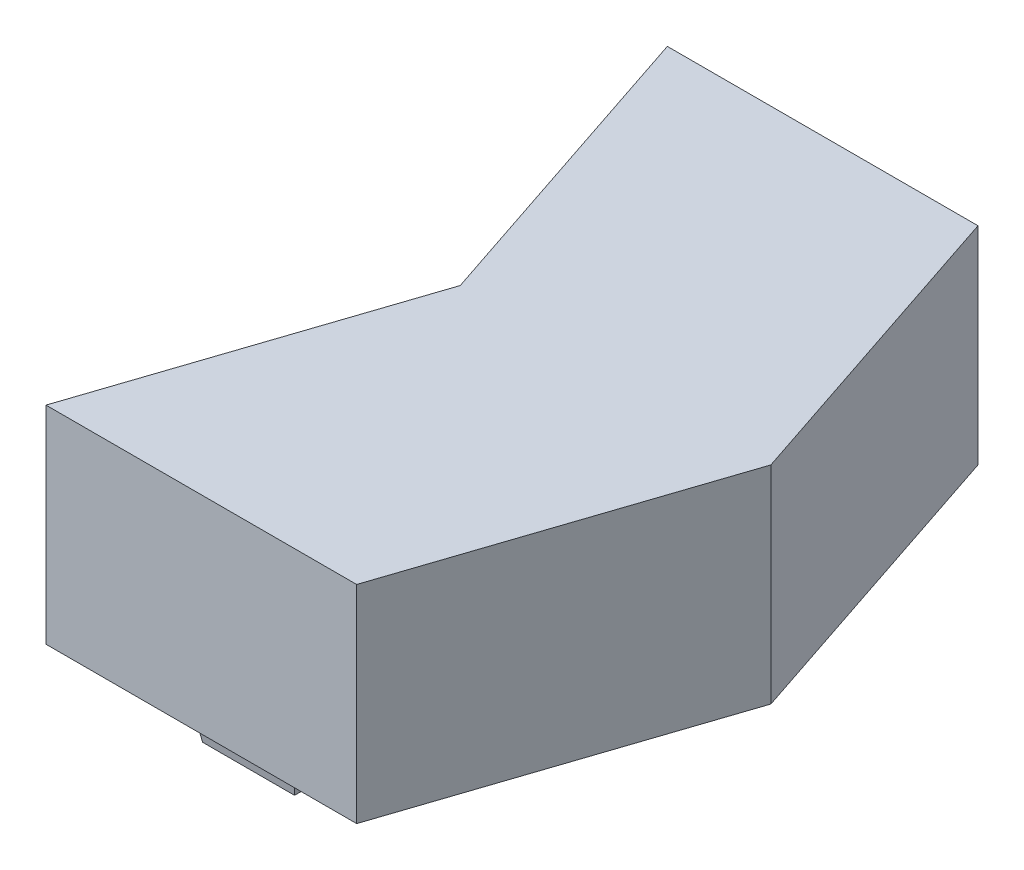
from build123d import *

# Parameters (mm, degrees)
BOSS_EXTRUDE1_DEPTH       = 12.7
SKETCH2_R                 = 5.635000033
HAPTIC_MOTOR_CUTOUT_DEPTH = 9.557999934
SKETCH3_W                 = 2.54
SKETCH3_H                 = 3.81
HAPTIC_WIRE_CUTOUT_DEPTH  = 9.557999934
SKETCH4_W                 = 6.35
SKETCH4_H                 = 2.54
PINS_DEPTH                = 2.032
PINS_TAPER                = 10


with BuildPart() as part:
    # Sketch1 → Boss-Extrude1 (new body)
    with BuildSketch(Plane(origin=(0, 0, 0), x_dir=(1, 0, 0), z_dir=(0, 1, 0))):
        Polygon((0, 0), (19.05, 0), (25.4, 19.05), (19.05, 38.1), (0, 38.1), (6.35, 19.05), align=None)
    extrude(amount=BOSS_EXTRUDE1_DEPTH)

    # Sketch2 → Haptic Motor Cutout (cut)
    with BuildSketch(Plane.XZ):
        with Locations((15.24, -19.05)):
            Circle(SKETCH2_R)
    extrude(amount=-HAPTIC_MOTOR_CUTOUT_DEPTH, mode=Mode.SUBTRACT)

    # Sketch3 → Haptic Wire Cutout (cut)
    with BuildSketch(Plane.XZ):
        with Locations((15.24, -26.445020526)):
            Rectangle(SKETCH3_W, SKETCH3_H)
    extrude(amount=-HAPTIC_WIRE_CUTOUT_DEPTH, mode=Mode.SUBTRACT)

    # Sketch4 → Pins (add)
    with BuildSketch(Plane.XZ):
        with Locations((10.795, -35.56)):
            Rectangle(SKETCH4_W, SKETCH4_H)
    pins = extrude(amount=PINS_DEPTH, taper=PINS_TAPER)

    # Mirror1: Pins across plane
    add(pins.mirror(Plane(origin=(0, 0, -19.05), x_dir=(1, 0, 0), z_dir=(0, 0, -1))))


solid = part.part
